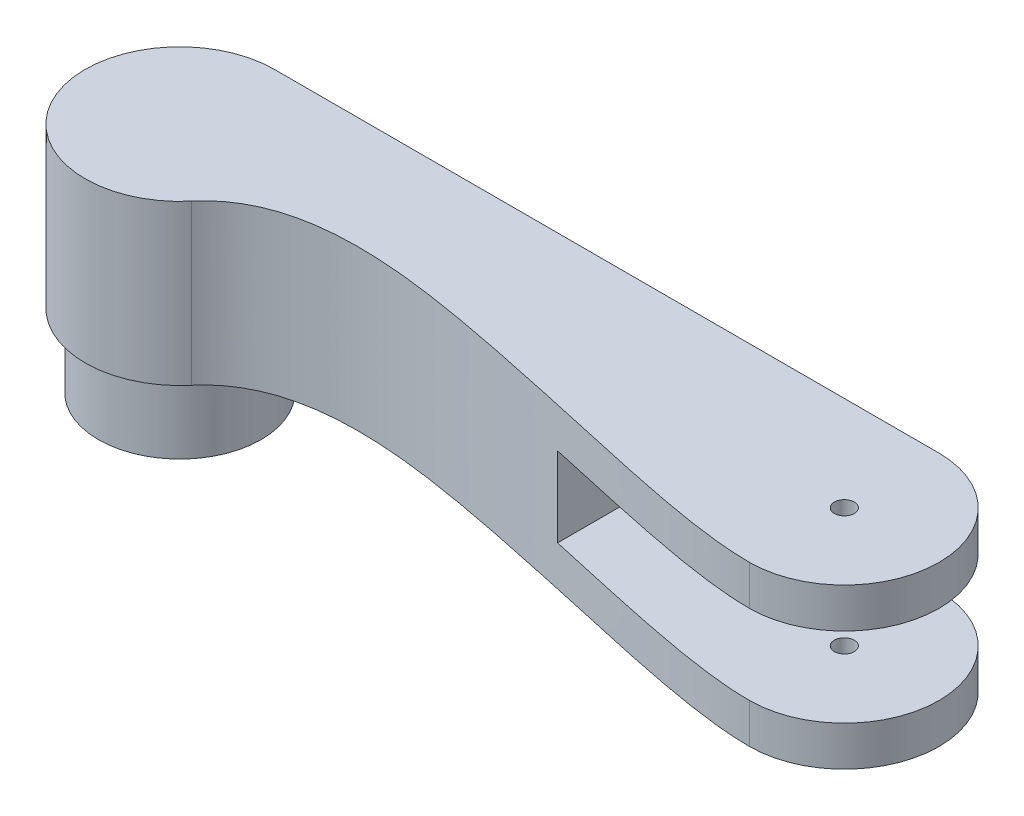
from build123d import *

# Parameters (mm, degrees)
BOSS_EXTRUDE1_DEPTH = 6
SKETCH3_R           = 1.5
CUT_EXTRUDE2_DEPTH  = 67.08422656
BOSS_EXTRUDE2_DEPTH = 12
BOSS_EXTRUDE3_DEPTH = 6
CUT_EXTRUDE3_REACH  = 72.051
SKETCH6_R           = 1.5
CUT_EXTRUDE4_REACH  = 72.051
SKETCH8_R           = 12.25
BOSS_EXTRUDE4_DEPTH = 11
SKETCH9_R           = 2.5
CUT_EXTRUDE5_DEPTH  = 6


with BuildPart() as part:
    # Sketch1 → Boss-Extrude1 (new body)
    with BuildSketch(Plane(origin=(0, 0, 0), x_dir=(1, 0, 0), z_dir=(0, 1, 0))):
        with BuildLine():
            Line((-50, 14.25), (50, 14.25))
            ThreePointArc((50, 14.25), (64.25, 0), (50, -14.25))
            Line((50, -14.25), (-50, -14.25))
            ThreePointArc((-50, -14.25), (-64.25, 0), (-50, 14.25))
        make_face()
    extrude(amount=BOSS_EXTRUDE1_DEPTH)

    # Sketch3 → Cut-Extrude2 (cut, through all)
    with BuildSketch(Plane.XZ):
        with Locations((50, 0)):
            Circle(SKETCH3_R)
    extrude(amount=-CUT_EXTRUDE2_DEPTH, mode=Mode.SUBTRACT)

    # Sketch4 → Boss-Extrude2 (add)
    with BuildSketch(Plane(origin=(0, 6, 0), x_dir=(1, 0, 0), z_dir=(0, 1, 0))):
        with BuildLine():
            Line((-50, 14.25), (15, 14.25))
            Line((15, 14.25), (15, -14.25))
            Line((15, -14.25), (-50, -14.25))
            ThreePointArc((-50, -14.25), (-64.25, 0), (-50, 14.25))
        make_face()
    extrude(amount=BOSS_EXTRUDE2_DEPTH)

    # Sketch5 → Boss-Extrude3 (add)
    with BuildSketch(Plane(origin=(0, 18, 0), x_dir=(1, 0, 0), z_dir=(0, 1, 0))):
        with BuildLine():
            Line((-50, 14.25), (50, 14.25))
            ThreePointArc((50, 14.25), (64.25, 0), (50, -14.25))
            Line((50, -14.25), (-50, -14.25))
            ThreePointArc((-50, -14.25), (-64.25, 0), (-50, 14.25))
        make_face()
    extrude(amount=BOSS_EXTRUDE3_DEPTH)

    # Sketch6 → Cut-Extrude3 (cut, up to next)
    with BuildSketch(Plane(origin=(0, 24, 0), x_dir=(1, 0, 0), z_dir=(0, 1, 0)), mode=Mode.PRIVATE) as cut_extrude3_sk1:
        with Locations((50, 0)):
            Circle(SKETCH6_R)
    cut_extrude3_tool1 = extrude(cut_extrude3_sk1.sketch, amount=-CUT_EXTRUDE3_REACH, mode=Mode.PRIVATE) & part.part
    add(cut_extrude3_tool1.solids().sort_by_distance((50, 24, 0))[0], mode=Mode.SUBTRACT)

    # Sketch7 → Cut-Extrude4 (cut, up to next)
    with BuildSketch(Plane(origin=(0, 24, 0), x_dir=(1, 0, 0), z_dir=(0, 1, 0)), mode=Mode.PRIVATE) as cut_extrude4_sk1:
        with BuildLine():
            ThreePointArc((-39.07315683, -9.146944754), (-43.970135273, -12.911360555), (-50, -14.25))
            Line((-50, -14.25), (50, -14.25))
            add(Edge.make_bspline(
                [(-39.07315683, -9.146944754), (-31.514094033, -0.116968526), (5.438655837, -4.645240543), (38.697514387, -14.25), (50, -14.25)],
                knots=[0, 0, 0, 0, 0.435907903, 1, 1, 1, 1], degree=3))
        make_face()
    cut_extrude4_tool1 = extrude(cut_extrude4_sk1.sketch, amount=-CUT_EXTRUDE4_REACH, mode=Mode.PRIVATE) & part.part
    add(cut_extrude4_tool1.solids().sort_by_distance((-8.590717, 24, 9.791359))[0], mode=Mode.SUBTRACT)

    # Sketch8 → Boss-Extrude4 (add)
    with BuildSketch(Plane.XZ):
        with Locations((-50, 0)):
            Circle(SKETCH8_R)
    extrude(amount=BOSS_EXTRUDE4_DEPTH)

    # Sketch9 → Cut-Extrude5 (cut)
    with BuildSketch(Plane.XZ.offset(11)):
        with Locations((-50, 8.25)):
            Circle(SKETCH9_R)
        with Locations((-50, -8.25)):
            Circle(SKETCH9_R)
    extrude(amount=-CUT_EXTRUDE5_DEPTH, mode=Mode.SUBTRACT)


solid = part.part
